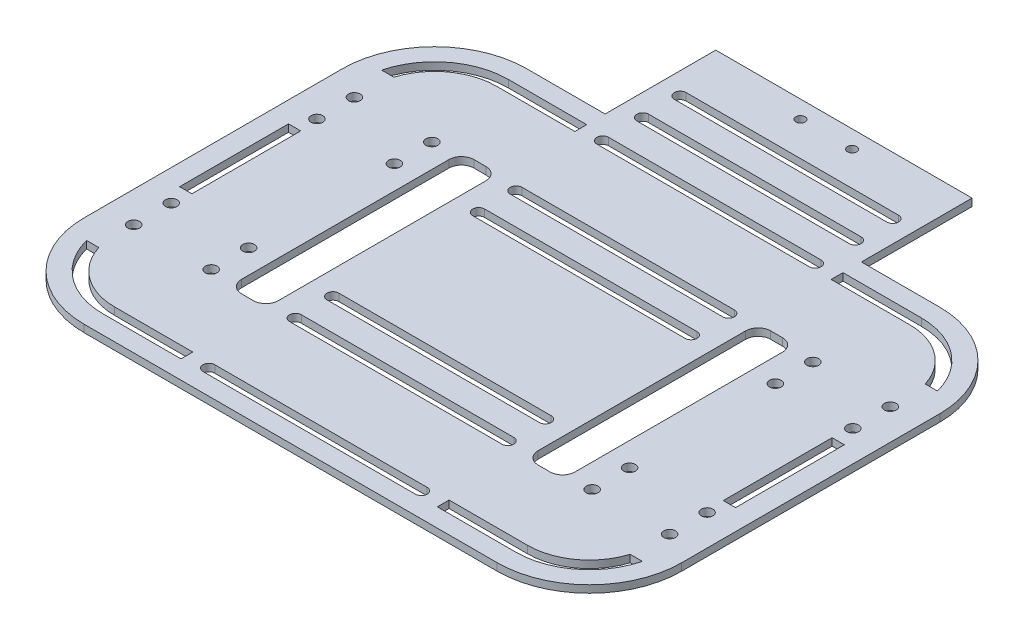
from build123d import *

# Parameters (mm, degrees)
SKETCH1_R            = 1.5875
BOSS_EXTRUDE5_DEPTH  = 1.5875
FILLET2_R            = 2.54
FILLET3_R            = 2.54
FILLET4_R            = 5.08
CUT_EXTRUDE1_START   = -2.54
SKETCH2_R            = 2.38125
SKETCH2_R_2          = 1.5875
CUT_EXTRUDE1_DEPTH   = 2.54
SKETCH3_R            = 1.5875
CUT_EXTRUDE2_DEPTH   = 2.54
CUT_EXTRUDE3_DEPTH   = 2.54
SKETCH5_W            = 15
SKETCH5_H            = 34.925
CUT_EXTRUDE4_DEPTH   = 109.650407999
FILLET5_R            = 7.62
FILLET6_R            = 7.62
SKETCH6_R            = 79.375
CUT_EXTRUDE5_DEPTH   = 0.5875
SKETCH8_W            = 24.650607139
SKETCH8_H            = 2
SKETCH8_W_2          = 29.436542116
CUT_EXTRUDE6_DEPTH   = 2.54
FILLET7_R            = 2.54
SKETCH11_W           = 22.261978792
SKETCH11_H           = 11.326269911
SKETCH11_H_2         = 10.545147849
BOSS_EXTRUDE7_DEPTH  = 1
SKETCH12_R           = 1.25
CUT_EXTRUDE7_DEPTH   = 2.54
SKETCH14_R           = 1.5875
BOSS_EXTRUDE8_DEPTH  = 1
SKETCH15_R           = 1.5875
CUT_EXTRUDE8_DEPTH   = 2.54
SKETCH16_W           = 0.79375
SKETCH16_H           = 25.283333333
SKETCH16_H_2         = 48.566666667
SKETCH16_H_3         = 73.85
BOSS_EXTRUDE13_DEPTH = 1
CUT_EXTRUDE10_DEPTH  = 109.643412285
BOSS_EXTRUDE16_START = -1
BOSS_EXTRUDE16_DEPTH = 1
SKETCH19_R           = 1.25
BOSS_EXTRUDE20_DEPTH = 2
SKETCH20_R           = 1.5875
CUT_EXTRUDE13_DEPTH  = 2
CUT_EXTRUDE18_DEPTH  = 2
SKETCH24_R           = 79.375
CUT_EXTRUDE20_DEPTH  = 297.956328007
SKETCH25_R           = 1.5875
SKETCH25_W           = 21
SKETCH25_H           = 70
BOSS_EXTRUDE22_DEPTH = 2
SKETCH26_R           = 1.5875
BOSS_EXTRUDE23_DEPTH = 2
SKETCH27_R           = 1.5875
CUT_EXTRUDE22_DEPTH  = 2
SKETCH28_W           = 36.479656017
SKETCH28_H           = 15.802247307
BOSS_EXTRUDE24_DEPTH = 2
CUT_EXTRUDE23_DEPTH  = 10


with BuildPart() as part:
    # Sketch1 → Boss-Extrude5 (new body)
    with BuildSketch(Plane(origin=(0, 0, 0), x_dir=(1, 0, 0), z_dir=(0, 1, 0))):
        with BuildLine():
            ThreePointArc((-63.5, -47.625), (-35.497579143, -70.995158286), (0, -79.375))
            ThreePointArc((0, -79.375), (35.497579143, -70.995158286), (63.5, -47.625))
            Line((63.5, -47.625), (50.8, -47.625))
            Line((50.8, -47.625), (50.8, 22.225))
            Line((50.8, 22.225), (76.2, 22.225))
            ThreePointArc((76.2, 22.225), (0, 79.375), (-76.2, 22.225))
            Line((-76.2, 22.225), (-50.8, 22.225))
            Line((-50.8, 22.225), (-50.8, -47.625))
            Line((-50.8, -47.625), (-63.5, -47.625))
        make_face()
        with Locations(Location((-7.14375, -66.675, 0), (0, 0, 270))):
            Circle(SKETCH1_R, mode=Mode.SUBTRACT)
        with BuildLine():
            ThreePointArc((8.73125, -66.675), (7.14375, -68.2625), (5.55625, -66.675))
            ThreePointArc((5.55625, -66.675), (7.14375, -65.0875), (8.73125, -66.675))
        make_face(mode=Mode.SUBTRACT)
        with Locations(Location((-7.14375, 66.675, 0), (0, 0, 270))):
            Circle(SKETCH1_R, mode=Mode.SUBTRACT)
        with Locations(Location((7.14375, 66.675, 0), (0, 0, 270))):
            Circle(SKETCH1_R, mode=Mode.SUBTRACT)
    extrude(amount=BOSS_EXTRUDE5_DEPTH)

    # Fillet2
    fillet2_edges = [part.edges().sort_by_distance(p)[0] for p in [
        (-63.5, 0.79375, 47.625),
    ]]
    fillet(fillet2_edges, radius=FILLET2_R)

    # Fillet3
    fillet3_edges = [part.edges().sort_by_distance(p)[0] for p in [
        (63.5, 0.79375, 47.625),
    ]]
    fillet(fillet3_edges, radius=FILLET3_R)

    # Fillet4
    fillet4_edges = [part.edges().sort_by_distance(p)[0] for p in [
        (-76.2, 0.79375, -22.225),
        (76.2, 0.79375, -22.225),
    ]]
    fillet(fillet4_edges, radius=FILLET4_R)

    # Sketch2 → Cut-Extrude1 (cut)
    # profile 1 of 10: a face of its own
    with BuildSketch(Plane(origin=(0, 1.5875, 0), x_dir=(1, 0, 0), z_dir=(0, 1, 0)).offset(CUT_EXTRUDE1_START)):
        with BuildLine():
            Line((-61.088622125, 27.654457796), (-59.642408406, 26.999765402))
            ThreePointArc((-59.642408406, 26.999765402), (-52.384826382, 39.268743005), (-42.643785254, 49.676068599))
            Line((-42.643785254, 49.676068599), (-43.677815048, 50.880617741))
            Line((-43.677815048, 50.880617741), (-44.711844841, 52.085166883))
            ThreePointArc((-44.711844841, 52.085166883), (-54.925289002, 41.173126022), (-62.534835843, 28.309150189))
            Line((-62.534835843, 28.309150189), (-61.088622125, 27.654457796))
        make_face()
    # profile 2 of 10: a face of its own
    with BuildSketch(Plane(origin=(0, 1.5875, 0), x_dir=(1, 0, 0), z_dir=(0, 1, 0)).offset(CUT_EXTRUDE1_START)):
        with BuildLine():
            Line((-39.077069744, 54.493774041), (-38.151958122, 53.203686937))
            ThreePointArc((-38.151958122, 53.203686937), (-25.732218917, 60.200142208), (-12.092567045, 64.342629994))
            Line((-12.092567045, 64.342629994), (-12.385788543, 65.902815048))
            Line((-12.385788543, 65.902815048), (-12.679010041, 67.463000102))
            ThreePointArc((-12.679010041, 67.463000102), (-26.980132574, 63.119617589), (-40.002181367, 55.783861145))
            Line((-40.002181367, 55.783861145), (-39.077069744, 54.493774041))
        make_face()
    # profile 3 of 10: a face of its own
    with BuildSketch(Plane(origin=(0, 1.5875, 0), x_dir=(1, 0, 0), z_dir=(0, 1, 0)).offset(CUT_EXTRUDE1_START)):
        with Locations(Location((-7.14375, 66.675, 0), (0, 0, 270))):
            Circle(SKETCH2_R)
        with Locations((-7.14375, 66.675)):
            Circle(SKETCH2_R_2, mode=Mode.SUBTRACT)
    # profile 4 of 10: a face of its own
    with BuildSketch(Plane(origin=(0, 1.5875, 0), x_dir=(1, 0, 0), z_dir=(0, 1, 0)).offset(CUT_EXTRUDE1_START)):
        with Locations(Location((7.14375, 66.675, 0), (0, 0, 270))):
            Circle(SKETCH2_R)
        with Locations((7.14375, 66.675)):
            Circle(SKETCH2_R_2, mode=Mode.SUBTRACT)
    # profile 5 of 10: a face of its own
    with BuildSketch(Plane(origin=(0, 1.5875, 0), x_dir=(1, 0, 0), z_dir=(0, 1, 0)).offset(CUT_EXTRUDE1_START)):
        with BuildLine():
            ThreePointArc((12.679010041, 67.463000102), (26.980132574, 63.119617589), (40.002181367, 55.783861145))
            Line((40.002181367, 55.783861145), (39.077069744, 54.493774041))
            Line((39.077069744, 54.493774041), (38.151958122, 53.203686937))
            ThreePointArc((38.151958122, 53.203686937), (25.732218917, 60.200142208), (12.092567045, 64.342629994))
            Line((12.092567045, 64.342629994), (12.385788543, 65.902815048))
            Line((12.385788543, 65.902815048), (12.679010041, 67.463000102))
        make_face()
    # profile 6 of 10: a face of its own
    with BuildSketch(Plane(origin=(0, 1.5875, 0), x_dir=(1, 0, 0), z_dir=(0, 1, 0)).offset(CUT_EXTRUDE1_START)):
        with BuildLine():
            ThreePointArc((44.711844841, 52.085166883), (54.925289002, 41.173126022), (62.534835843, 28.309150189))
            Line((62.534835843, 28.309150189), (59.642408406, 26.999765402))
            ThreePointArc((59.642408406, 26.999765402), (52.384826382, 39.268743005), (42.643785254, 49.676068599))
            Line((42.643785254, 49.676068599), (43.677815048, 50.880617741))
            Line((43.677815048, 50.880617741), (44.711844841, 52.085166883))
        make_face()
    # profile 7 of 10: a face of its own
    with BuildSketch(Plane(origin=(0, 1.5875, 0), x_dir=(1, 0, 0), z_dir=(0, 1, 0)).offset(CUT_EXTRUDE1_START)):
        with BuildLine():
            ThreePointArc((-12.679010041, -67.463000102), (-26.980132574, -63.119617589), (-40.002181367, -55.783861145))
            Line((-40.002181367, -55.783861145), (-39.077069744, -54.493774041))
            Line((-39.077069744, -54.493774041), (-38.151958122, -53.203686937))
            ThreePointArc((-38.151958122, -53.203686937), (-25.732218917, -60.200142208), (-12.092567045, -64.342629994))
            Line((-12.092567045, -64.342629994), (-12.385788543, -65.902815048))
            Line((-12.385788543, -65.902815048), (-12.679010041, -67.463000102))
        make_face()
    # profile 8 of 10: a face of its own
    with BuildSketch(Plane(origin=(0, 1.5875, 0), x_dir=(1, 0, 0), z_dir=(0, 1, 0)).offset(CUT_EXTRUDE1_START)):
        with Locations(Location((-7.14375, -66.675, 0), (0, 0, 270))):
            Circle(SKETCH2_R)
        with Locations((-7.14375, -66.675)):
            Circle(SKETCH2_R_2, mode=Mode.SUBTRACT)
    # profile 9 of 10: a face of its own
    with BuildSketch(Plane(origin=(0, 1.5875, 0), x_dir=(1, 0, 0), z_dir=(0, 1, 0)).offset(CUT_EXTRUDE1_START)):
        with Locations(Location((7.14375, -66.675, 0), (0, 0, 270))):
            Circle(SKETCH2_R)
        with Locations((7.14375, -66.675)):
            Circle(SKETCH2_R_2, mode=Mode.SUBTRACT)
    # profile 10 of 10: a face of its own
    with BuildSketch(Plane(origin=(0, 1.5875, 0), x_dir=(1, 0, 0), z_dir=(0, 1, 0)).offset(CUT_EXTRUDE1_START)):
        with BuildLine():
            ThreePointArc((12.092567045, -64.342629994), (25.732218917, -60.200142208), (38.151958122, -53.203686937))
            Line((38.151958122, -53.203686937), (39.077069744, -54.493774041))
            Line((39.077069744, -54.493774041), (40.002181367, -55.783861145))
            ThreePointArc((40.002181367, -55.783861145), (26.980132574, -63.119617589), (12.679010041, -67.463000102))
            Line((12.679010041, -67.463000102), (12.385788543, -65.902815048))
            Line((12.385788543, -65.902815048), (12.092567045, -64.342629994))
        make_face()
    extrude(amount=CUT_EXTRUDE1_DEPTH, mode=Mode.SUBTRACT)

    # Sketch3 → Cut-Extrude2 (cut)
    with BuildSketch(Plane(origin=(0, 1.5875, 0), x_dir=(1, 0, 0), z_dir=(0, 1, 0))):
        with Locations(Location((-44.45, -47.625, 0), (0, 0, 270))):
            Circle(SKETCH3_R)
        with Locations(Location((-44.45, 22.225, 0), (0, 0, 270))):
            Circle(SKETCH3_R)
        with Locations(Location((44.45, 22.225, 0), (0, 0, 270))):
            Circle(SKETCH3_R)
        with Locations(Location((44.45, -47.625, 0), (0, 0, 270))):
            Circle(SKETCH3_R)
    extrude(amount=-CUT_EXTRUDE2_DEPTH, mode=Mode.SUBTRACT)

    # Sketch4 → Cut-Extrude3 (cut)
    with BuildSketch(Plane(origin=(0, 1.5875, 0), x_dir=(1, 0, 0), z_dir=(0, 1, 0))):
        with BuildLine():
            ThreePointArc((-44.45, -11.1125), (-46.0375, -12.7), (-44.45, -14.2875))
            Line((-44.45, -14.2875), (-44.45, -11.1125))
        make_face()
        with BuildLine():
            Line((-44.45, -11.1125), (-44.45, -14.2875))
            ThreePointArc((-44.45, -14.2875), (-43.327467985, -13.822532015), (-42.8625, -12.7))
            ThreePointArc((-42.8625, -12.7), (-43.327467985, -11.577467985), (-44.45, -11.1125))
        make_face()
        with BuildLine():
            ThreePointArc((44.45, -11.1125), (42.8625, -12.7), (44.45, -14.2875))
            Line((44.45, -14.2875), (44.45, -11.1125))
        make_face()
        with BuildLine():
            Line((44.45, -11.1125), (44.45, -14.2875))
            ThreePointArc((44.45, -14.2875), (45.572532015, -13.822532015), (46.0375, -12.7))
            ThreePointArc((46.0375, -12.7), (45.572532015, -11.577467985), (44.45, -11.1125))
        make_face()
    extrude(amount=-CUT_EXTRUDE3_DEPTH, mode=Mode.SUBTRACT)

    # Sketch5 → Cut-Extrude4 (cut, through all)
    with BuildSketch(Plane(origin=(0, 1.5875, 0), x_dir=(1, 0, 0), z_dir=(0, 1, 0))):
        with Locations((-27.3, 4.7625)):
            Rectangle(SKETCH5_W, SKETCH5_H)
        with Locations((27.3, 4.7625)):
            Rectangle(SKETCH5_W, SKETCH5_H)
    extrude(amount=-CUT_EXTRUDE4_DEPTH, mode=Mode.SUBTRACT)

    # Fillet5
    # the kernel refuses this fillet: 7.62 mm, written as the material it adds along each edge
    with BuildSketch(Plane(origin=(-19.8, 1.5875, 12.7), x_dir=(0, 0, -1), z_dir=(0, -1, 0))) as fillet5_piece_1:
        with BuildLine():
            CenterArc((FILLET5_R, -FILLET5_R), FILLET5_R, 90, 90)
            Line((0, -FILLET5_R), (0, 0))
            Line((0, 0), (FILLET5_R, 0))
        make_face()
    extrude(amount=1.5875)
    with BuildSketch(Plane(origin=(-34.8, 1.5875, 12.7), x_dir=(0, 0, -1), z_dir=(0, -1, 0)), Plane(origin=(-19.8, 1.5875, -22.225), x_dir=(0, 0, 1), z_dir=(0, -1, 0)), Plane(origin=(-34.8, 1.5875, -22.225), x_dir=(1, 0, 0), z_dir=(0, -1, 0))) as fillet5_piece_2:
        with BuildLine():
            CenterArc((FILLET5_R, FILLET5_R), FILLET5_R, 180, 90)
            Line((0, FILLET5_R), (0, 0))
            Line((0, 0), (FILLET5_R, 0))
        make_face()
    extrude(amount=1.5875)

    # Fillet6
    # the kernel refuses this fillet: 7.62 mm, written as the material it adds along each edge
    with BuildSketch(Plane(origin=(34.8, 1.5875, 12.7), x_dir=(0, 0, -1), z_dir=(0, -1, 0)), Plane(origin=(34.8, 1.5875, -22.225), x_dir=(-1, 0, 0), z_dir=(0, -1, 0))) as fillet6_piece_1:
        with BuildLine():
            CenterArc((FILLET6_R, -FILLET6_R), FILLET6_R, 90, 90)
            Line((0, -FILLET6_R), (0, 0))
            Line((0, 0), (FILLET6_R, 0))
        make_face()
    extrude(amount=1.5875)
    with BuildSketch(Plane(origin=(19.8, 1.5875, -22.225), x_dir=(1, 0, 0), z_dir=(0, -1, 0)), Plane(origin=(19.8, 1.5875, 12.7), x_dir=(0, 0, -1), z_dir=(0, -1, 0))) as fillet6_piece_2:
        with BuildLine():
            CenterArc((FILLET6_R, FILLET6_R), FILLET6_R, 180, 90)
            Line((0, FILLET6_R), (0, 0))
            Line((0, 0), (FILLET6_R, 0))
        make_face()
    extrude(amount=1.5875)

    # Sketch6 → Cut-Extrude5 (cut)
    with BuildSketch(Plane(origin=(0, 0, 0), x_dir=(-1, 0, 0), z_dir=(0, -1, 0))):
        Circle(SKETCH6_R)
    extrude(amount=-CUT_EXTRUDE5_DEPTH, mode=Mode.SUBTRACT)

    # Sketch8 → Cut-Extrude6 (cut)
    with BuildSketch(Plane(origin=(0, 1.5875, 0), x_dir=(1, 0, 0), z_dir=(0, 1, 0))):
        with Locations((-63.12530357, -48.625)):
            Rectangle(SKETCH8_W, SKETCH8_H)
        with Locations((63.12530357, -48.625)):
            Rectangle(SKETCH8_W, SKETCH8_H)
        with Locations((65.518271058, 23.225)):
            Rectangle(SKETCH8_W_2, SKETCH8_H)
        with Locations((-65.518271058, 23.225)):
            Rectangle(SKETCH8_W_2, SKETCH8_H)
    extrude(amount=-CUT_EXTRUDE6_DEPTH, mode=Mode.SUBTRACT)

    # Fillet7
    fillet7_edges = [part.edges().sort_by_distance(p)[0] for p in [
        (-73.13527216, 1.0875, -24.225),
    ]]
    fillet(fillet7_edges, radius=FILLET7_R)
    fillet7_2_edges = [part.edges().sort_by_distance(p)[0] for p in [
        (-60.680646055, 1.0875, 49.625),
    ]]
    fillet(fillet7_2_edges, radius=FILLET7_R)
    fillet7_3_edges = [part.edges().sort_by_distance(p)[0] for p in [
        (73.13527216, 1.0875, -24.225),
    ]]
    fillet(fillet7_3_edges, radius=FILLET7_R)
    fillet7_4_edges = [part.edges().sort_by_distance(p)[0] for p in [
        (60.680646055, 1.0875, 49.625),
    ]]
    fillet(fillet7_4_edges, radius=FILLET7_R)

    # Sketch11 → Boss-Extrude7 (add)
    with BuildSketch(Plane(origin=(0, 1.5875, 0), x_dir=(1, 0, 0), z_dir=(0, 1, 0))):
        with Locations((0.072710042, 66.44599468)):
            Rectangle(SKETCH11_W, SKETCH11_H)
        with Locations((0.072710042, -66.930597559)):
            Rectangle(SKETCH11_W, SKETCH11_H_2)
    extrude(amount=-BOSS_EXTRUDE7_DEPTH)

    # Sketch12 → Cut-Extrude7 (cut)
    with BuildSketch(Plane(origin=(0, 1.5875, 0), x_dir=(1, 0, 0), z_dir=(0, 1, 0))):
        with Locations(Location((-6.75, 65.902815048, 0), (0, 0, 270))):
            Circle(SKETCH12_R)
        with Locations(Location((6.75, 65.902815048, 0), (0, 0, 270))):
            Circle(SKETCH12_R)
        with Locations(Location((6.75, -65.902815048, 0), (0, 0, 270))):
            Circle(SKETCH12_R)
        with Locations(Location((-6.75, -65.902815048, 0), (0, 0, 270))):
            Circle(SKETCH12_R)
    extrude(amount=-CUT_EXTRUDE7_DEPTH, mode=Mode.SUBTRACT)

    # Sketch14 → Boss-Extrude8 (add)
    with BuildSketch(Plane(origin=(0, 1.5875, 0), x_dir=(1, 0, 0), z_dir=(0, 1, 0))):
        with Locations((-44.45, -12.7)):
            Circle(SKETCH14_R)
        with Locations((44.45, -12.7)):
            Circle(SKETCH14_R)
    extrude(amount=-BOSS_EXTRUDE8_DEPTH)

    # Sketch15 → Cut-Extrude8 (cut)
    with BuildSketch(Plane(origin=(0, 1.5875, 0), x_dir=(1, 0, 0), z_dir=(0, 1, 0))):
        with Locations(Location((-44.45, -1.058333333, 0), (0, 0, 270))):
            Circle(SKETCH15_R)
        with Locations(Location((-44.45, -24.341666667, 0), (0, 0, 270))):
            Circle(SKETCH15_R)
        with Locations(Location((44.45, -24.341666667, 0), (0, 0, 270))):
            Circle(SKETCH15_R)
        with Locations(Location((44.45, -1.058333333, 0), (0, 0, 270))):
            Circle(SKETCH15_R)
    extrude(amount=-CUT_EXTRUDE8_DEPTH, mode=Mode.SUBTRACT)

    # Sketch16 → Boss-Extrude13 (add)
    with BuildSketch(Plane(origin=(0, 1.5875, 0), x_dir=(1, 0, 0), z_dir=(0, 1, 0))):
        with Locations((-51.196875, 11.583333334)):
            Rectangle(SKETCH16_W, SKETCH16_H)
        with Locations((-51.196875, -25.341666667)):
            Rectangle(SKETCH16_W, SKETCH16_H_2)
        with Locations((51.196875, -12.7)):
            Rectangle(SKETCH16_W, SKETCH16_H_3)
    extrude(amount=-BOSS_EXTRUDE13_DEPTH)

    # Sketch17 → Cut-Extrude10 (cut, through all)
    with BuildSketch(Plane(origin=(0, 1.5875, 0), x_dir=(1, 0, 0), z_dir=(0, 1, 0))):
        with BuildLine():
            ThreePointArc((-59.642408406, 26.999765402), (-40.146347222, 51.715326712), (-11.368591443, 64.474485968))
            Line((-11.368591443, 64.474485968), (-11.919924408, 67.601250584))
            ThreePointArc((-11.919924408, 67.601250584), (-42.093290669, 54.223321173), (-62.534835843, 28.309150189))
            Line((-62.534835843, 28.309150189), (-59.642408406, 26.999765402))
        make_face()
        with BuildLine():
            Line((11.919924408, 67.601250584), (11.368591443, 64.474485968))
            ThreePointArc((11.368591443, 64.474485968), (40.146347222, 51.715326712), (59.642408406, 26.999765402))
            Line((59.642408406, 26.999765402), (62.534835843, 28.309150189))
            ThreePointArc((62.534835843, 28.309150189), (42.093290669, 54.223321173), (11.919924408, 67.601250584))
        make_face()
        with BuildLine():
            ThreePointArc((38.151958122, -53.203686937), (25.393482136, -60.343808939), (11.368591443, -64.474485968))
            Line((11.368591443, -64.474485968), (11.919924408, -67.601250584))
            ThreePointArc((11.919924408, -67.601250584), (26.624968362, -63.270251604), (40.002181367, -55.783861145))
            Line((40.002181367, -55.783861145), (38.151958122, -53.203686937))
        make_face()
        with BuildLine():
            ThreePointArc((-11.368591443, -64.474485968), (-25.393482136, -60.343808939), (-38.151958122, -53.203686937))
            Line((-38.151958122, -53.203686937), (-40.002181367, -55.783861145))
            ThreePointArc((-40.002181367, -55.783861145), (-26.624968362, -63.270251604), (-11.919924408, -67.601250584))
            Line((-11.919924408, -67.601250584), (-11.368591443, -64.474485968))
        make_face()
    extrude(amount=-CUT_EXTRUDE10_DEPTH, mode=Mode.SUBTRACT)

    # Sketch18 → Boss-Extrude16 (add)
    with BuildSketch(Plane(origin=(0, 1.5875, 0), x_dir=(1, 0, 0), z_dir=(0, 1, 0)).offset(BOSS_EXTRUDE16_START)):
        with BuildLine():
            Line((-34.32205442, -59.447542075), (-32.73455442, -56.697911418))
            ThreePointArc((-32.73455442, -56.697911418), (-35.486290539, -55.017518992), (-38.151958122, -53.203686937))
            Line((-38.151958122, -53.203686937), (-40.002181367, -55.783861145))
            ThreePointArc((-40.002181367, -55.783861145), (-37.207239159, -57.685657078), (-34.32205442, -59.447542075))
        make_face()
        with BuildLine():
            ThreePointArc((38.151958122, -53.203686937), (35.486290539, -55.017518992), (32.73455442, -56.697911418))
            Line((32.73455442, -56.697911418), (34.32205442, -59.447542075))
            ThreePointArc((34.32205442, -59.447542075), (37.207239159, -57.685657078), (40.002181367, -55.783861145))
            Line((40.002181367, -55.783861145), (38.151958122, -53.203686937))
        make_face()
        with BuildLine():
            Line((59.447542075, 34.32205442), (56.697911418, 32.73455442))
            ThreePointArc((56.697911418, 32.73455442), (58.240788589, 29.90342383), (59.642408406, 26.999765402))
            Line((59.642408406, 26.999765402), (62.534835843, 28.309150189))
            ThreePointArc((62.534835843, 28.309150189), (61.065242855, 31.353624885), (59.447542075, 34.32205442))
        make_face()
        with BuildLine():
            Line((34.32205442, 59.447542075), (32.73455442, 56.697911418))
            ThreePointArc((32.73455442, 56.697911418), (37.551538139, 53.629154344), (42.082731979, 50.152247023))
            Line((42.082731979, 50.152247023), (44.12358264, 52.584438129))
            ThreePointArc((44.12358264, 52.584438129), (39.372643325, 56.229962084), (34.32205442, 59.447542075))
        make_face()
        with BuildLine():
            ThreePointArc((-42.082731979, 50.152247023), (-37.551538139, 53.629154344), (-32.73455442, 56.697911418))
            Line((-32.73455442, 56.697911418), (-34.32205442, 59.447542075))
            ThreePointArc((-34.32205442, 59.447542075), (-39.372643325, 56.229962084), (-44.12358264, 52.584438129))
            Line((-44.12358264, 52.584438129), (-42.082731979, 50.152247023))
        make_face()
        with BuildLine():
            ThreePointArc((-59.642408406, 26.999765402), (-58.240788589, 29.90342383), (-56.697911418, 32.73455442))
            Line((-56.697911418, 32.73455442), (-59.447542075, 34.32205442))
            ThreePointArc((-59.447542075, 34.32205442), (-61.065242855, 31.353624885), (-62.534835843, 28.309150189))
            Line((-62.534835843, 28.309150189), (-59.642408406, 26.999765402))
        make_face()
    extrude(amount=BOSS_EXTRUDE16_DEPTH)

    # Sketch24 → Cut-Extrude20 (cut, through all)
    with BuildSketch(Plane(origin=(0, 3.5875, 0), x_dir=(1, 0, 0), z_dir=(0, 1, 0))):
        Circle(SKETCH24_R)
    extrude(amount=-CUT_EXTRUDE20_DEPTH, mode=Mode.SUBTRACT)


with BuildPart() as body_2:
    # Sketch19 → Boss-Extrude20 (new body)
    with BuildSketch(Plane(origin=(0, 1.5875, 0), x_dir=(1, 0, 0), z_dir=(0, 1, 0))):
        with BuildLine():
            Line((33.700005206, 185.112408933), (33.700005206, 150.112408933))
            Line((33.700005206, 150.112408933), (33.700005206, 115.112408933))
            Line((33.700005206, 115.112408933), (12.700005206, 115.112408933))
            ThreePointArc((12.700005206, 115.112408933), (20.022335677, 97.434739403), (37.700005206, 90.112408933))
            Line((37.700005206, 90.112408933), (93.700005206, 90.112408933))
            Line((93.700005206, 90.112408933), (149.700005206, 90.112408933))
            ThreePointArc((149.700005206, 90.112408933), (167.377674736, 97.434739403), (174.700005206, 115.112408933))
            Line((174.700005206, 115.112408933), (153.700005206, 115.112408933))
            Line((153.700005206, 115.112408933), (153.700005206, 150.112408933))
            Line((153.700005206, 150.112408933), (153.700005206, 185.112408933))
            Line((153.700005206, 185.112408933), (174.700005206, 185.112408933))
            ThreePointArc((174.700005206, 185.112408933), (167.377674736, 202.790078463), (149.700005206, 210.112408933))
            Line((149.700005206, 210.112408933), (128.446980003, 210.112408933))
            Line((128.446980003, 210.112408933), (128.446980003, 240.112408933))
            Line((128.446980003, 240.112408933), (58.95303041, 240.112408933))
            Line((58.95303041, 240.112408933), (58.95303041, 210.112408933))
            Line((58.95303041, 210.112408933), (37.700005206, 210.112408933))
            ThreePointArc((37.700005206, 210.112408933), (20.022335677, 202.790078463), (12.700005206, 185.112408933))
            Line((12.700005206, 185.112408933), (33.700005206, 185.112408933))
        make_face()
        with Locations(Location((86.693968484, 94.895303866, 0), (0, 0, 270))):
            Circle(SKETCH19_R, mode=Mode.SUBTRACT)
        with Locations(Location((100.706041929, 235.329514, 0), (0, 0, 270))):
            Circle(SKETCH19_R, mode=Mode.SUBTRACT)
        with Locations(Location((100.706041929, 94.895303866, 0), (0, 0, 270))):
            Circle(SKETCH19_R, mode=Mode.SUBTRACT)
        with Locations(Location((86.693968484, 235.329514, 0), (0, 0, 270))):
            Circle(SKETCH19_R, mode=Mode.SUBTRACT)
    extrude(amount=BOSS_EXTRUDE20_DEPTH)

    # Sketch20 → Cut-Extrude13 (cut)
    with BuildSketch(Plane(origin=(0, 3.5875, 0), x_dir=(1, 0, 0), z_dir=(0, 1, 0))):
        with Locations(Location((42.050005206, 180.032408933, 0), (0, 0, 270))):
            Circle(SKETCH20_R)
        with Locations(Location((42.050005206, 169.872408933, 0), (0, 0, 270))):
            Circle(SKETCH20_R)
        with Locations(Location((42.050005206, 130.352408933, 0), (0, 0, 270))):
            Circle(SKETCH20_R)
        with Locations(Location((42.050005206, 120.192408933, 0), (0, 0, 270))):
            Circle(SKETCH20_R)
        with Locations(Location((145.350005206, 120.192408933, 0), (0, 0, 270))):
            Circle(SKETCH20_R)
        with Locations(Location((145.350005206, 130.352408933, 0), (0, 0, 270))):
            Circle(SKETCH20_R)
        with Locations(Location((145.350005206, 169.872408933, 0), (0, 0, 270))):
            Circle(SKETCH20_R)
        with Locations(Location((145.350005206, 180.032408933, 0), (0, 0, 270))):
            Circle(SKETCH20_R)
    extrude(amount=-CUT_EXTRUDE13_DEPTH, mode=Mode.SUBTRACT)

    # Sketch23 → Cut-Extrude18 (cut)
    with BuildSketch(Plane(origin=(0, 3.5875, 0), x_dir=(1, 0, 0), z_dir=(0, 1, 0))):
        with BuildLine():
            Line((122.496980003, 181.632408933), (64.90303041, 181.632408933))
            ThreePointArc((64.90303041, 181.632408933), (63.30303041, 180.032408933), (64.90303041, 178.432408933))
            Line((64.90303041, 178.432408933), (122.496980003, 178.432408933))
            ThreePointArc((122.496980003, 178.432408933), (124.096980003, 180.032408933), (122.496980003, 181.632408933))
        make_face()
        with BuildLine():
            Line((55.076517808, 181.632408933), (51.876517808, 181.632408933))
            ThreePointArc((51.876517808, 181.632408933), (49.472354752, 180.636571989), (48.476517808, 178.232408933))
            Line((48.476517808, 178.232408933), (48.476517808, 121.992408933))
            ThreePointArc((48.476517808, 121.992408933), (49.472354752, 119.588245877), (51.876517808, 118.592408933))
            Line((51.876517808, 118.592408933), (55.076517808, 118.592408933))
            ThreePointArc((55.076517808, 118.592408933), (57.480680864, 119.588245877), (58.476517808, 121.992408933))
            Line((58.476517808, 121.992408933), (58.476517808, 178.232408933))
            ThreePointArc((58.476517808, 178.232408933), (57.480680864, 180.636571989), (55.076517808, 181.632408933))
        make_face()
        with BuildLine():
            ThreePointArc((37.700005206, 205.112408933), (25.452556492, 200.923797234), (18.335088475, 190.112408933))
            Line((18.335088475, 190.112408933), (21.661302017, 190.112408933))
            ThreePointArc((21.661302017, 190.112408933), (27.744102435, 198.644592792), (37.700005206, 201.912408933))
            Line((37.700005206, 201.912408933), (58.95303041, 201.912408933))
            Line((58.95303041, 201.912408933), (58.95303041, 205.112408933))
            Line((58.95303041, 205.112408933), (37.700005206, 205.112408933))
        make_face()
        with BuildLine():
            ThreePointArc((122.496980003, 222.932408933), (124.096980003, 224.532408933), (122.496980003, 226.132408933))
            Line((122.496980003, 226.132408933), (64.90303041, 226.132408933))
            ThreePointArc((64.90303041, 226.132408933), (63.30303041, 224.532408933), (64.90303041, 222.932408933))
            Line((64.90303041, 222.932408933), (122.496980003, 222.932408933))
        make_face()
        with BuildLine():
            ThreePointArc((122.496980003, 168.272408933), (124.096980003, 169.872408933), (122.496980003, 171.472408933))
            Line((122.496980003, 171.472408933), (64.90303041, 171.472408933))
            ThreePointArc((64.90303041, 171.472408933), (63.30303041, 169.872408933), (64.90303041, 168.272408933))
            Line((64.90303041, 168.272408933), (122.496980003, 168.272408933))
        make_face()
        with BuildLine():
            Line((165.738708396, 190.112408933), (169.064921937, 190.112408933))
            ThreePointArc((169.064921937, 190.112408933), (161.94745392, 200.923797234), (149.700005206, 205.112408933))
            Line((149.700005206, 205.112408933), (128.446980003, 205.112408933))
            Line((128.446980003, 205.112408933), (128.446980003, 201.912408933))
            Line((128.446980003, 201.912408933), (149.700005206, 201.912408933))
            ThreePointArc((149.700005206, 201.912408933), (159.655907978, 198.644592792), (165.738708396, 190.112408933))
        make_face()
        with BuildLine():
            ThreePointArc((122.496980003, 212.772408933), (124.096980003, 214.372408933), (122.496980003, 215.972408933))
            Line((122.496980003, 215.972408933), (64.90303041, 215.972408933))
            ThreePointArc((64.90303041, 215.972408933), (63.30303041, 214.372408933), (64.90303041, 212.772408933))
            Line((64.90303041, 212.772408933), (122.496980003, 212.772408933))
        make_face()
        with BuildLine():
            Line((122.496980003, 131.952408933), (64.90303041, 131.952408933))
            ThreePointArc((64.90303041, 131.952408933), (63.30303041, 130.352408933), (64.90303041, 128.752408933))
            Line((64.90303041, 128.752408933), (122.496980003, 128.752408933))
            ThreePointArc((122.496980003, 128.752408933), (124.096980003, 130.352408933), (122.496980003, 131.952408933))
        make_face()
        with BuildLine():
            ThreePointArc((122.496980003, 118.592408933), (124.096980003, 120.192408933), (122.496980003, 121.792408933))
            Line((122.496980003, 121.792408933), (64.90303041, 121.792408933))
            ThreePointArc((64.90303041, 121.792408933), (63.30303041, 120.192408933), (64.90303041, 118.592408933))
            Line((64.90303041, 118.592408933), (122.496980003, 118.592408933))
        make_face()
        with BuildLine():
            Line((122.496980003, 205.112408933), (64.90303041, 205.112408933))
            ThreePointArc((64.90303041, 205.112408933), (63.30303041, 203.512408933), (64.90303041, 201.912408933))
            Line((64.90303041, 201.912408933), (122.496980003, 201.912408933))
            ThreePointArc((122.496980003, 201.912408933), (124.096980003, 203.512408933), (122.496980003, 205.112408933))
        make_face()
        with BuildLine():
            Line((21.661302017, 110.112408933), (18.335088475, 110.112408933))
            ThreePointArc((18.335088475, 110.112408933), (25.452556492, 99.301020632), (37.700005206, 95.112408933))
            Line((37.700005206, 95.112408933), (58.95303041, 95.112408933))
            Line((58.95303041, 95.112408933), (58.95303041, 98.312408933))
            Line((58.95303041, 98.312408933), (37.700005206, 98.312408933))
            ThreePointArc((37.700005206, 98.312408933), (27.744102435, 101.580225074), (21.661302017, 110.112408933))
        make_face()
        with BuildLine():
            Line((128.446980003, 95.112408933), (149.700005206, 95.112408933))
            ThreePointArc((149.700005206, 95.112408933), (161.94745392, 99.301020632), (169.064921937, 110.112408933))
            Line((169.064921937, 110.112408933), (165.738708396, 110.112408933))
            ThreePointArc((165.738708396, 110.112408933), (159.655907978, 101.580225074), (149.700005206, 98.312408933))
            Line((149.700005206, 98.312408933), (128.446980003, 98.312408933))
            Line((128.446980003, 98.312408933), (128.446980003, 95.112408933))
        make_face()
        with BuildLine():
            ThreePointArc((135.523492605, 118.592408933), (137.927655661, 119.588245877), (138.923492605, 121.992408933))
            Line((138.923492605, 121.992408933), (138.923492605, 178.232408933))
            ThreePointArc((138.923492605, 178.232408933), (137.927655661, 180.636571989), (135.523492605, 181.632408933))
            Line((135.523492605, 181.632408933), (132.323492605, 181.632408933))
            ThreePointArc((132.323492605, 181.632408933), (129.919329549, 180.636571989), (128.923492605, 178.232408933))
            Line((128.923492605, 178.232408933), (128.923492605, 121.992408933))
            ThreePointArc((128.923492605, 121.992408933), (129.919329549, 119.588245877), (132.323492605, 118.592408933))
            Line((132.323492605, 118.592408933), (135.523492605, 118.592408933))
        make_face()
    extrude(amount=-CUT_EXTRUDE18_DEPTH, mode=Mode.SUBTRACT)

    # Sketch25 → Boss-Extrude22 (add)
    # profile 1 of 2: a face of its own
    with BuildSketch(Plane(origin=(0, 3.5875, 0), x_dir=(1, 0, 0), z_dir=(0, 1, 0))):
        Polygon((12.700005206, 115.112408933), (33.700005206, 115.112408933), (33.700005206, 185.112408933), (31.024100226, 185.112408933), (12.700005206, 185.112408933), align=None)
        Polygon((19.998195246, 135.352408933), (18.335088475, 135.352408933), (18.335088475, 164.872408933), (19.998195246, 164.872408933), (21.661302017, 164.872408933), (21.661302017, 135.352408933), align=None, mode=Mode.SUBTRACT)
        with Locations(Location((19.998195246, 120.192408933, 0), (0, 0, 270))):
            Circle(SKETCH25_R, mode=Mode.SUBTRACT)
        with Locations(Location((19.998195246, 130.352408933, 0), (0, 0, 270))):
            Circle(SKETCH25_R, mode=Mode.SUBTRACT)
        with Locations(Location((19.998195246, 169.872408933, 0), (0, 0, 270))):
            Circle(SKETCH25_R, mode=Mode.SUBTRACT)
        with Locations(Location((19.998195246, 180.032408933, 0), (0, 0, 270))):
            Circle(SKETCH25_R, mode=Mode.SUBTRACT)
    # profile 2 of 2: a face of its own
    with BuildSketch(Plane(origin=(0, 3.5875, 0), x_dir=(1, 0, 0), z_dir=(0, 1, 0))):
        with Locations((164.200005206, 150.112408933)):
            Rectangle(SKETCH25_W, SKETCH25_H)
        with Locations(Location((167.401815167, 120.192408933, 0), (0, 0, 270))):
            Circle(SKETCH25_R, mode=Mode.SUBTRACT)
        with Locations(Location((167.401815167, 130.352408933, 0), (0, 0, 270))):
            Circle(SKETCH25_R, mode=Mode.SUBTRACT)
        Polygon((167.401815167, 135.352408933), (165.738708396, 135.352408933), (165.738708396, 164.872408933), (167.401815167, 164.872408933), (169.064921937, 164.872408933), (169.064921937, 135.352408933), align=None, mode=Mode.SUBTRACT)
        with Locations(Location((167.401815167, 169.872408933, 0), (0, 0, 270))):
            Circle(SKETCH25_R, mode=Mode.SUBTRACT)
        with Locations(Location((167.401815167, 180.032408933, 0), (0, 0, 270))):
            Circle(SKETCH25_R, mode=Mode.SUBTRACT)
    extrude(amount=-BOSS_EXTRUDE22_DEPTH)

    # Sketch26 → Boss-Extrude23 (add)
    with BuildSketch(Plane(origin=(0, 3.5875, 0), x_dir=(1, 0, 0), z_dir=(0, 1, 0))):
        with Locations((167.401815167, 180.032408933)):
            Circle(SKETCH26_R)
        with Locations((167.401815167, 169.872408933)):
            Circle(SKETCH26_R)
        with Locations((167.401815167, 130.352408933)):
            Circle(SKETCH26_R)
        with Locations((167.401815167, 120.192408933)):
            Circle(SKETCH26_R)
        with Locations((19.998195246, 120.192408933)):
            Circle(SKETCH26_R)
        with Locations((19.998195246, 130.352408933)):
            Circle(SKETCH26_R)
        with Locations((19.998195246, 169.872408933)):
            Circle(SKETCH26_R)
        with Locations((19.998195246, 180.032408933)):
            Circle(SKETCH26_R)
    extrude(amount=-BOSS_EXTRUDE23_DEPTH)

    # Sketch27 → Cut-Extrude22 (cut)
    with BuildSketch(Plane(origin=(0, 3.5875, 0), x_dir=(1, 0, 0), z_dir=(0, 1, 0))):
        with Locations(Location((21.050005206, 180.032408933, 0), (0, 0, 270))):
            Circle(SKETCH27_R)
        with Locations(Location((21.050005206, 169.872408933, 0), (0, 0, 270))):
            Circle(SKETCH27_R)
        with Locations(Location((21.050005206, 130.352408933, 0), (0, 0, 90))):
            Circle(SKETCH27_R)
        with Locations(Location((21.050005206, 120.192408933, 0), (0, 0, 90))):
            Circle(SKETCH27_R)
        with Locations(Location((166.350005206, 120.192408933, 0), (0, 0, 270))):
            Circle(SKETCH27_R)
        with Locations(Location((166.350005206, 130.352408933, 0), (0, 0, 270))):
            Circle(SKETCH27_R)
        with Locations(Location((166.350005206, 169.872408933, 0), (0, 0, 90))):
            Circle(SKETCH27_R)
        with Locations(Location((166.350005206, 180.032408933, 0), (0, 0, 90))):
            Circle(SKETCH27_R)
    extrude(amount=-CUT_EXTRUDE22_DEPTH, mode=Mode.SUBTRACT)

    # Sketch28 → Boss-Extrude24 (add)
    with BuildSketch(Plane(origin=(0, 3.5875, 0), x_dir=(1, 0, 0), z_dir=(0, 1, 0))):
        with Locations((94.755764466, 99.488754938)):
            Rectangle(SKETCH28_W, SKETCH28_H)
    extrude(amount=-BOSS_EXTRUDE24_DEPTH)

    # Sketch29 → Cut-Extrude23 (cut)
    with BuildSketch(Plane(origin=(0, 3.5875, 0), x_dir=(1, 0, 0), z_dir=(0, 1, 0))):
        with BuildLine():
            ThreePointArc((122.496980003, 98.312408933), (124.096980003, 96.712408933), (122.496980003, 95.112408933))
            Line((122.496980003, 95.112408933), (64.90303041, 95.112408933))
            ThreePointArc((64.90303041, 95.112408933), (63.30303041, 96.712408933), (64.90303041, 98.312408933))
            Line((64.90303041, 98.312408933), (122.496980003, 98.312408933))
        make_face()
    extrude(amount=-CUT_EXTRUDE23_DEPTH, mode=Mode.SUBTRACT)


solid = body_2.part
